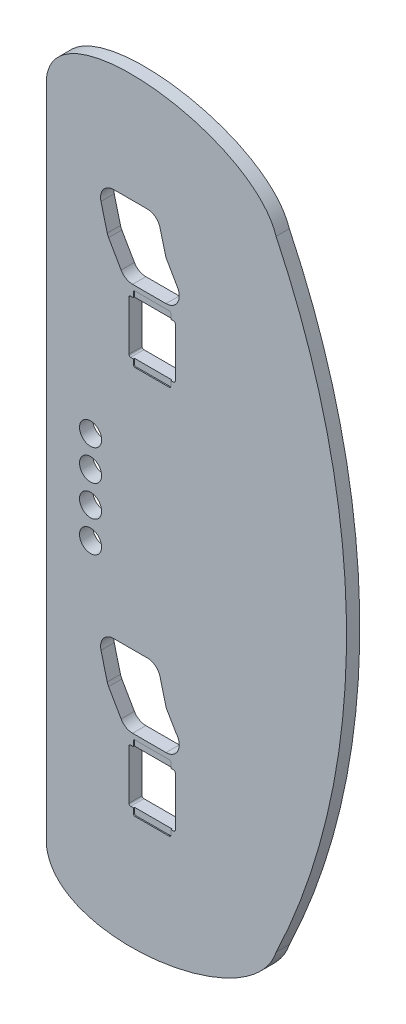
from build123d import *

# Parameters (mm, degrees)
SKETCH4_R           = 15.875
BOSS_EXTRUDE6_DEPTH = 19.05
BOSS_EXTRUDE7_DEPTH = 17.4625


with BuildPart() as part:
    # Sketch4 → Boss-Extrude6 (new body)
    with BuildSketch(Plane.XY):
        with BuildLine():
            add(Edge.make_bspline(
                [(1691.296561672, 1918.177904127), (1656.762851887, 2023.18607917), (1371.325091688, 2058.930160841), (1361.096561672, 1948.863494174)],
                knots=[0, 0, 0, 0, 7.638294788, 7.638294788, 7.638294788, 7.638294788], degree=3))
            Line((1361.096561672, 1948.863494174), (1361.096561672, 996.363494174))
            add(Edge.make_bspline(
                [(1691.296561672, 1027.049084222), (1656.707719979, 922.059056278), (1371.325091688, 886.296827508), (1361.096561672, 996.363494174)],
                knots=[0, 0, 0, 0, 7.629784399, 7.629784399, 7.629784399, 7.629784399], degree=3))
            ThreePointArc((1691.296561672, 1027.049084222), (1792.519416014, 1472.613494174), (1691.296561672, 1918.177904127))
        make_face()
        with BuildLine():
            Line((1488.60074179, 1189.913462674), (1513.04824179, 1189.913462674))
            Line((1513.04824179, 1189.913462674), (1537.49574179, 1189.913462674))
            ThreePointArc((1537.49574179, 1189.913462674), (1539.291793014, 1189.169513898), (1540.03574179, 1187.373462674))
            Line((1540.03574179, 1187.373462674), (1540.03574179, 1180.388462674))
            Line((1540.03574179, 1180.388462674), (1543.84574179, 1180.388462674))
            ThreePointArc((1543.84574179, 1180.388462674), (1545.641793014, 1179.644513898), (1546.38574179, 1177.848462674))
            Line((1546.38574179, 1177.848462674), (1546.38574179, 1106.728462674))
            ThreePointArc((1546.38574179, 1106.728462674), (1545.641793014, 1104.93241145), (1543.84574179, 1104.188462674))
            Line((1543.84574179, 1104.188462674), (1540.03574179, 1104.188462674))
            Line((1540.03574179, 1104.188462674), (1540.03574179, 1097.203462674))
            ThreePointArc((1540.03574179, 1097.203462674), (1539.291793014, 1095.40741145), (1537.49574179, 1094.663462674))
            Line((1537.49574179, 1094.663462674), (1488.60074179, 1094.663462674))
            ThreePointArc((1488.60074179, 1094.663462674), (1486.804690566, 1095.40741145), (1486.06074179, 1097.203462674))
            Line((1486.06074179, 1097.203462674), (1486.06074179, 1104.188462674))
            Line((1486.06074179, 1104.188462674), (1482.25074179, 1104.188462674))
            ThreePointArc((1482.25074179, 1104.188462674), (1480.454690566, 1104.93241145), (1479.71074179, 1106.728462674))
            Line((1479.71074179, 1106.728462674), (1479.71074179, 1177.848462674))
            ThreePointArc((1479.71074179, 1177.848462674), (1480.454690566, 1179.644513898), (1482.25074179, 1180.388462674))
            Line((1482.25074179, 1180.388462674), (1486.06074179, 1180.388462674))
            Line((1486.06074179, 1180.388462674), (1486.06074179, 1187.373462674))
            ThreePointArc((1486.06074179, 1187.373462674), (1486.804690566, 1189.169513898), (1488.60074179, 1189.913462674))
        make_face(mode=Mode.SUBTRACT)
        with Locations((1424.596561672, 1405.938494174)):
            Circle(SKETCH4_R, mode=Mode.SUBTRACT)
        with Locations((1424.596561672, 1450.388494174)):
            Circle(SKETCH4_R, mode=Mode.SUBTRACT)
        with BuildLine():
            Line((1448.599054653, 1242.069282307), (1439.599047253, 1277.069212307))
            ThreePointArc((1439.599047253, 1277.069212307), (1443.530372909, 1294.147019672), (1459.747970005, 1300.787529462))
            Line((1459.747970005, 1300.787529462), (1504.349628175, 1300.787529462))
            ThreePointArc((1504.349628175, 1300.787529462), (1517.03821718, 1297.374125496), (1524.498550926, 1286.557701042))
            Line((1524.498550926, 1286.557701042), (1533.38304498, 1252.006988342))
            Line((1533.38304498, 1252.006988342), (1547.541432032, 1227.927383263))
            ThreePointArc((1547.541432032, 1227.927383263), (1549.470421095, 1225.219175121), (1550.899143934, 1222.21681918))
            ThreePointArc((1550.899143934, 1222.21681918), (1548.695609175, 1204.697126576), (1533.04876059, 1196.513525674))
            Line((1533.04876059, 1196.513525674), (1513.04824179, 1196.513525674))
            Line((1513.04824179, 1196.513525674), (1485.04883119, 1196.513525674))
            ThreePointArc((1485.04883119, 1196.513525674), (1475.515471645, 1199.070570942), (1468.54140154, 1206.0552521))
            Line((1468.54140154, 1206.0552521), (1450.54141214, 1237.3052531))
            ThreePointArc((1450.54141214, 1237.3052531), (1449.408667615, 1239.621395205), (1448.599054653, 1242.069282307))
        make_face(mode=Mode.SUBTRACT)
        with Locations((1424.596561672, 1494.838494174)):
            Circle(SKETCH4_R, mode=Mode.SUBTRACT)
        with Locations((1424.596561672, 1539.288494174)):
            Circle(SKETCH4_R, mode=Mode.SUBTRACT)
        with BuildLine():
            Line((1540.03574179, 1662.988462674), (1540.03574179, 1656.003462674))
            ThreePointArc((1540.03574179, 1656.003462674), (1539.291793014, 1654.20741145), (1537.49574179, 1653.463462674))
            Line((1537.49574179, 1653.463462674), (1488.60074179, 1653.463462674))
            ThreePointArc((1488.60074179, 1653.463462674), (1486.804690566, 1654.20741145), (1486.06074179, 1656.003462674))
            Line((1486.06074179, 1656.003462674), (1486.06074179, 1662.988462674))
            Line((1486.06074179, 1662.988462674), (1482.25074179, 1662.988462674))
            ThreePointArc((1482.25074179, 1662.988462674), (1480.454690566, 1663.73241145), (1479.71074179, 1665.528462674))
            Line((1479.71074179, 1665.528462674), (1479.71074179, 1736.648462674))
            ThreePointArc((1479.71074179, 1736.648462674), (1480.454690566, 1738.444513898), (1482.25074179, 1739.188462674))
            Line((1482.25074179, 1739.188462674), (1486.06074179, 1739.188462674))
            Line((1486.06074179, 1739.188462674), (1486.06074179, 1746.173462674))
            ThreePointArc((1486.06074179, 1746.173462674), (1486.804690566, 1747.969513898), (1488.60074179, 1748.713462674))
            Line((1488.60074179, 1748.713462674), (1513.04824179, 1748.713462674))
            Line((1513.04824179, 1748.713462674), (1537.49574179, 1748.713462674))
            ThreePointArc((1537.49574179, 1748.713462674), (1539.291793014, 1747.969513898), (1540.03574179, 1746.173462674))
            Line((1540.03574179, 1746.173462674), (1540.03574179, 1739.188462674))
            Line((1540.03574179, 1739.188462674), (1543.84574179, 1739.188462674))
            ThreePointArc((1543.84574179, 1739.188462674), (1545.641793014, 1738.444513898), (1546.38574179, 1736.648462674))
            Line((1546.38574179, 1736.648462674), (1546.38574179, 1665.528462674))
            ThreePointArc((1546.38574179, 1665.528462674), (1545.641793014, 1663.73241145), (1543.84574179, 1662.988462674))
            Line((1543.84574179, 1662.988462674), (1540.03574179, 1662.988462674))
        make_face(mode=Mode.SUBTRACT)
        with BuildLine():
            Line((1533.04876059, 1755.313525674), (1513.04824179, 1755.313525674))
            Line((1513.04824179, 1755.313525674), (1485.04883119, 1755.313525674))
            ThreePointArc((1485.04883119, 1755.313525674), (1475.515471645, 1757.870570942), (1468.54140154, 1764.8552521))
            Line((1468.54140154, 1764.8552521), (1450.54141214, 1796.1052531))
            ThreePointArc((1450.54141214, 1796.1052531), (1449.408667615, 1798.421395205), (1448.599054653, 1800.869282307))
            Line((1448.599054653, 1800.869282307), (1439.599047253, 1835.869212307))
            ThreePointArc((1439.599047253, 1835.869212307), (1442.994261078, 1852.286602026), (1458.04883439, 1859.663456674))
            Line((1458.04883439, 1859.663456674), (1506.04876379, 1859.663456674))
            ThreePointArc((1506.04876379, 1859.663456674), (1517.721909142, 1855.668029986), (1524.498550926, 1845.357701042))
            Line((1524.498550926, 1845.357701042), (1532.852004601, 1812.872139543))
            Line((1532.852004601, 1812.872139543), (1549.556190239, 1783.871799249))
            ThreePointArc((1549.556190239, 1783.871799249), (1549.541715322, 1764.83016613), (1533.04876059, 1755.313525674))
        make_face(mode=Mode.SUBTRACT)
    extrude(amount=BOSS_EXTRUDE6_DEPTH)

    # Sketch13 → Boss-Extrude7 (add)
    with BuildSketch(Plane.XY):
        with BuildLine():
            Line((1537.49574179, 1189.913462674), (1488.60074179, 1189.913462674))
            ThreePointArc((1488.60074179, 1189.913462674), (1486.804690566, 1189.169513898), (1486.06074179, 1187.373462674))
            Line((1486.06074179, 1187.373462674), (1486.06074179, 1180.388462674))
            Line((1486.06074179, 1180.388462674), (1540.03574179, 1180.388462674))
            Line((1540.03574179, 1180.388462674), (1540.03574179, 1187.373462674))
            ThreePointArc((1540.03574179, 1187.373462674), (1539.291793014, 1189.169513898), (1537.49574179, 1189.913462674))
        make_face()
        with BuildLine():
            Line((1540.03574179, 1097.203462674), (1540.03574179, 1104.188462674))
            Line((1540.03574179, 1104.188462674), (1486.06074179, 1104.188462674))
            Line((1486.06074179, 1104.188462674), (1486.06074179, 1097.203462674))
            ThreePointArc((1486.06074179, 1097.203462674), (1486.804690566, 1095.40741145), (1488.60074179, 1094.663462674))
            Line((1488.60074179, 1094.663462674), (1537.49574179, 1094.663462674))
            ThreePointArc((1537.49574179, 1094.663462674), (1539.291793014, 1095.40741145), (1540.03574179, 1097.203462674))
        make_face()
        with BuildLine():
            ThreePointArc((1537.49574179, 1653.463462674), (1539.291793014, 1654.20741145), (1540.03574179, 1656.003462674))
            Line((1540.03574179, 1656.003462674), (1540.03574179, 1662.988462674))
            Line((1540.03574179, 1662.988462674), (1486.06074179, 1662.988462674))
            Line((1486.06074179, 1662.988462674), (1486.06074179, 1656.003462674))
            ThreePointArc((1486.06074179, 1656.003462674), (1486.804690566, 1654.20741145), (1488.60074179, 1653.463462674))
            Line((1488.60074179, 1653.463462674), (1537.49574179, 1653.463462674))
        make_face()
        with BuildLine():
            Line((1486.06074179, 1739.188462674), (1540.03574179, 1739.188462674))
            Line((1540.03574179, 1739.188462674), (1540.03574179, 1746.173462674))
            ThreePointArc((1540.03574179, 1746.173462674), (1539.291793014, 1747.969513898), (1537.49574179, 1748.713462674))
            Line((1537.49574179, 1748.713462674), (1488.60074179, 1748.713462674))
            ThreePointArc((1488.60074179, 1748.713462674), (1486.804690566, 1747.969513898), (1486.06074179, 1746.173462674))
            Line((1486.06074179, 1746.173462674), (1486.06074179, 1739.188462674))
        make_face()
    extrude(amount=BOSS_EXTRUDE7_DEPTH)


solid = part.part
